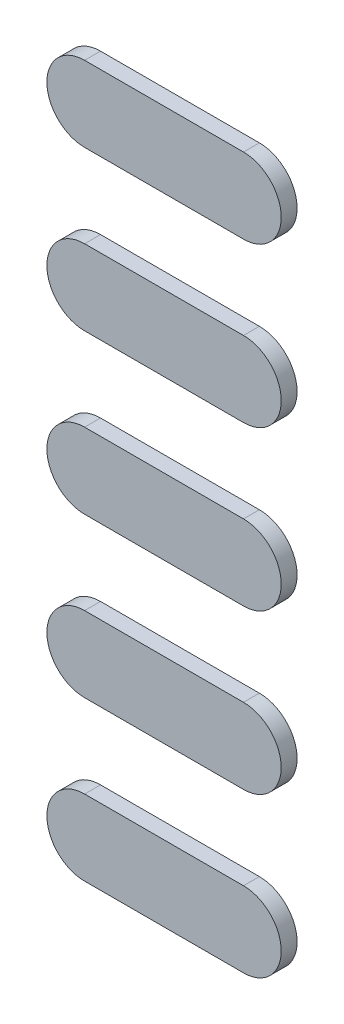
from build123d import *

# Parameters (mm, degrees)
BOSS_EXTRUDE1_DEPTH   = 2
BOSS_EXTRUDE1_2_DEPTH = 2
BOSS_EXTRUDE1_3_DEPTH = 2
BOSS_EXTRUDE1_4_DEPTH = 2
BOSS_EXTRUDE1_5_DEPTH = 2


with BuildPart() as part:
    # Sketch1 → Boss-Extrude1 (new body)
    with BuildSketch(Plane.XY):
        with BuildLine():
            Line((10, -4.75), (-10, -4.75))
            ThreePointArc((-10, -4.75), (-14.75, 0), (-10, 4.75))
            Line((-10, 4.75), (10, 4.75))
            ThreePointArc((10, 4.75), (14.75, 0), (10, -4.75))
        make_face()
    extrude(amount=BOSS_EXTRUDE1_DEPTH)


with BuildPart() as body_2:
    # Sketch1 → Boss-Extrude1 2 (new body)
    with BuildSketch(Plane.XY):
        with BuildLine():
            Line((10, 15.25), (-10, 15.25))
            ThreePointArc((-10, 15.25), (-14.75, 20), (-10, 24.75))
            Line((-10, 24.75), (10, 24.75))
            ThreePointArc((10, 24.75), (14.75, 20), (10, 15.25))
        make_face()
    extrude(amount=BOSS_EXTRUDE1_2_DEPTH)


with BuildPart() as body_3:
    # Sketch1 → Boss-Extrude1 3 (new body)
    with BuildSketch(Plane.XY):
        with BuildLine():
            Line((10, 35.25), (-10, 35.25))
            ThreePointArc((-10, 35.25), (-14.75, 40), (-10, 44.75))
            Line((-10, 44.75), (10, 44.75))
            ThreePointArc((10, 44.75), (14.75, 40), (10, 35.25))
        make_face()
    extrude(amount=BOSS_EXTRUDE1_3_DEPTH)


with BuildPart() as body_4:
    # Sketch1 → Boss-Extrude1 4 (new body)
    with BuildSketch(Plane.XY):
        with BuildLine():
            Line((10, -24.75), (-10, -24.75))
            ThreePointArc((-10, -24.75), (-14.75, -20), (-10, -15.25))
            Line((-10, -15.25), (10, -15.25))
            ThreePointArc((10, -15.25), (14.75, -20), (10, -24.75))
        make_face()
    extrude(amount=BOSS_EXTRUDE1_4_DEPTH)


with BuildPart() as body_5:
    # Sketch1 → Boss-Extrude1 5 (new body)
    with BuildSketch(Plane.XY):
        with BuildLine():
            Line((10, -44.75), (-10, -44.75))
            ThreePointArc((-10, -44.75), (-14.75, -40), (-10, -35.25))
            Line((-10, -35.25), (10, -35.25))
            ThreePointArc((10, -35.25), (14.75, -40), (10, -44.75))
        make_face()
    extrude(amount=BOSS_EXTRUDE1_5_DEPTH)


solid = Compound([part.part, body_2.part, body_3.part, body_4.part, body_5.part])
